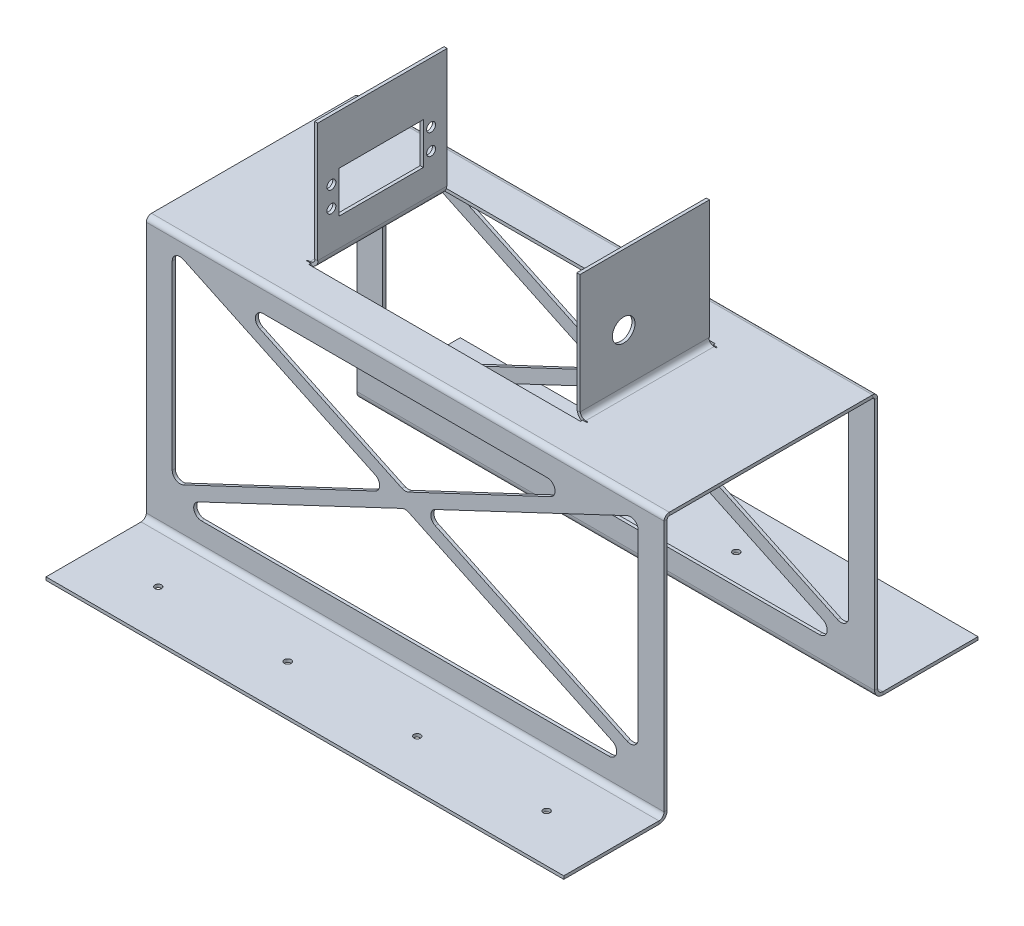
from build123d import *

# Parameters (mm, degrees)
SKETCH1_W                  = 254
SKETCH1_H                  = 50.8
BOSS_EXTRUDE1_DEPTH        = 1.5875
BOSS_EXTRUDE1_2_DEPTH      = 1.5875
SKETCH2_W                  = 254
SKETCH2_H                  = 1.5875
BOSS_EXTRUDE2_DEPTH        = 127
SKETCH3_W                  = 254
SKETCH3_H                  = 104.775
BOSS_EXTRUDE3_DEPTH        = 1.5875
CUT_EXTRUDE1_DEPTH         = 239.299561018
SKETCH5_W                  = 127
SKETCH5_H                  = 63.5
CUT_EXTRUDE2_DEPTH         = 209.31968372
SKETCH6_W                  = 1.5875
SKETCH6_H                  = 63.5
BOSS_EXTRUDE5_DEPTH        = 60.96
CUT_EXTRUDE4_REACH         = 291.401
SKETCH9_R                  = 2.1828125
SKETCH9_W                  = 41.275
SKETCH9_H                  = 20.32
CUT_EXTRUDE5_REACH         = 291.401
SKETCH10_R                 = 5.55625
FILLET1_START              = -31.75
FILLET1_DEPTH              = 63.5
FILLET1_START_2            = -127
FILLET1_2_DEPTH            = 254
FILLET1_START_3            = -33
FILLET1_3_DEPTH            = 66
FILLET1_START_4            = -128
FILLET1_4_DEPTH            = 256
CONVERT_SOLID2_START       = -49.8475
CONVERT_SOLID2_OUTLINE_W   = 133.35
CONVERT_SOLID2_OUTLINE_H   = 0.0635
CONVERT_SOLID2_DEPTH       = 99.695
CONVERT_SOLID2_START_2     = -31.9913
CONVERT_SOLID2_2_DEPTH     = 63.9826
CONVERT_SOLID2_3_DEPTH     = 99.695
CONVERT_SOLID2_START_3     = -103
CONVERT_SOLID2_4_OUTLINE_W = 254
CONVERT_SOLID2_4_OUTLINE_H = 0.0635
CONVERT_SOLID2_4_DEPTH     = 206
CONVERT_SOLID2_START_4     = -31.75
CONVERT_SOLID2_5_DEPTH     = 63.5
CONVERT_SOLID2_6_DEPTH     = 0.4826
CONVERT_SOLID2_START_5     = 31.5087
CONVERT_SOLID2_7_DEPTH     = 0.4826
CONVERT_SOLID2_START_6     = -128
CONVERT_SOLID2_8_DEPTH     = 256
SKETCH15_R                 = 1.63195
CUT_EXTRUDE6_DEPTH         = 250.759513845


with BuildPart() as part:
    # Sketch1 → Boss-Extrude1 (new body)
    with BuildSketch(Plane(origin=(0, 0, 0), x_dir=(1, 0, 0), z_dir=(0, 1, 0))):
        with Locations((0, -76.2)):
            Rectangle(SKETCH1_W, SKETCH1_H)
    extrude(amount=BOSS_EXTRUDE1_DEPTH)



with BuildPart() as body_2:
    # Sketch1 → Boss-Extrude1 2 (new body)
    with BuildSketch(Plane(origin=(0, 0, 0), x_dir=(1, 0, 0), z_dir=(0, 1, 0))):
        with Locations((0, 76.2)):
            Rectangle(SKETCH1_W, SKETCH1_H)
    extrude(amount=BOSS_EXTRUDE1_2_DEPTH)


with BuildPart() as part_1:
    add(part.part)

    add(body_2.part)  # Boss-Extrude2 merges body 2
    # Sketch2 → Boss-Extrude2 (add)
    with BuildSketch(Plane(origin=(0, 1.5875, 0), x_dir=(1, 0, 0), z_dir=(0, 1, 0))):
        with Locations((0, 51.59375)):
            Rectangle(SKETCH2_W, SKETCH2_H)
        with Locations((0, -51.59375)):
            Rectangle(SKETCH2_W, SKETCH2_H)
    extrude(amount=BOSS_EXTRUDE2_DEPTH)

    # Sketch3 → Boss-Extrude3 (add)
    with BuildSketch(Plane(origin=(0, 128.5875, 0), x_dir=(1, 0, 0), z_dir=(0, 1, 0))):
        Rectangle(SKETCH3_W, SKETCH3_H)
    extrude(amount=BOSS_EXTRUDE3_DEPTH)

    # Sketch4 → Cut-Extrude1 (cut, through all)
    with BuildSketch(Plane.XY.offset(52.3875)):
        with BuildLine():
            Line((-69.703104209, 117.475), (69.703104209, 117.475))
            ThreePointArc((69.703104209, 117.475), (73.420782502, 114.498647473), (71.329998233, 110.219812656))
            Line((71.329998233, 110.219812656), (1.626894024, 77.304457891))
            ThreePointArc((1.626894024, 77.304457891), (0, 76.939645235), (-1.626894024, 77.304457891))
            Line((-1.626894024, 77.304457891), (-71.329998233, 110.219812656))
            ThreePointArc((-71.329998233, 110.219812656), (-73.420782502, 114.498647473), (-69.703104209, 117.475))
        make_face()
        with BuildLine():
            Line((-114.3, 117.476188099), (-114.3, 28.573811901))
            ThreePointArc((-114.3, 28.573811901), (-112.52931775, 25.355538589), (-108.863105976, 25.128624557))
            Line((-108.863105976, 25.128624557), (-14.731178238, 69.579812656))
            ThreePointArc((-14.731178238, 69.579812656), (-12.548072262, 73.025), (-14.731178238, 76.470187344))
            Line((-14.731178238, 76.470187344), (-108.863105976, 120.921375443))
            ThreePointArc((-108.863105976, 120.921375443), (-112.52931775, 120.694461411), (-114.3, 117.476188099))
        make_face()
        with BuildLine():
            Line((-99.958986562, 14.2875), (99.958986562, 14.2875))
            ThreePointArc((99.958986562, 14.2875), (103.676664855, 17.263852527), (101.585880586, 21.542687344))
            Line((101.585880586, 21.542687344), (1.626894024, 68.745542109))
            ThreePointArc((1.626894024, 68.745542109), (0, 69.110354765), (-1.626894024, 68.745542109))
            Line((-1.626894024, 68.745542109), (-101.585880586, 21.542687344))
            ThreePointArc((-101.585880586, 21.542687344), (-103.676664855, 17.263852527), (-99.958986562, 14.2875))
        make_face()
        with BuildLine():
            Line((114.3, 117.476188099), (114.3, 28.573811901))
            ThreePointArc((114.3, 28.573811901), (112.52931775, 25.355538589), (108.863105976, 25.128624557))
            Line((108.863105976, 25.128624557), (14.731178238, 69.579812656))
            ThreePointArc((14.731178238, 69.579812656), (12.548072262, 73.025), (14.731178238, 76.470187344))
            Line((14.731178238, 76.470187344), (108.863105976, 120.921375443))
            ThreePointArc((108.863105976, 120.921375443), (112.52931775, 120.694461411), (114.3, 117.476188099))
        make_face()
    extrude(amount=-CUT_EXTRUDE1_DEPTH, mode=Mode.SUBTRACT)

    # Sketch5 → Cut-Extrude2 (cut, through all)
    with BuildSketch(Plane(origin=(0, 130.175, 0), x_dir=(1, 0, 0), z_dir=(0, 1, 0))):
        Rectangle(SKETCH5_W, SKETCH5_H)
        Polygon((63.5, 31.75), (66.675, 31.75), (66.675, 33.02), (-66.675, 33.02), (-66.675, 31.75), (-63.5, 31.75), align=None)
        Polygon((63.5, -31.75), (-63.5, -31.75), (-66.675, -31.75), (-66.675, -33.02), (66.675, -33.02), (66.675, -31.75), align=None)
    extrude(amount=-CUT_EXTRUDE2_DEPTH, mode=Mode.SUBTRACT)

    # Sketch6 → Boss-Extrude5 (add)
    with BuildSketch(Plane(origin=(0, 130.175, 0), x_dir=(1, 0, 0), z_dir=(0, 1, 0))):
        with Locations((-64.29375, 0)):
            Rectangle(SKETCH6_W, SKETCH6_H)
        with Locations((64.29375, 0)):
            Rectangle(SKETCH6_W, SKETCH6_H)
    extrude(amount=BOSS_EXTRUDE5_DEPTH)

    # Sketch9 → Cut-Extrude4 (cut, up to next)
    with BuildSketch(Plane.ZY.offset(65.0875), mode=Mode.PRIVATE) as cut_extrude4_sk1:
        with Locations((-23.870723231, 161.641924234)):
            Circle(SKETCH9_R)
    cut_extrude4_tool1 = extrude(cut_extrude4_sk1.sketch, amount=-CUT_EXTRUDE4_REACH, mode=Mode.PRIVATE) & part_1.part
    # Sketch9 → Cut-Extrude4 (cut, up to next)
    with BuildSketch(Plane.ZY.offset(65.0875), mode=Mode.PRIVATE) as cut_extrude4_sk2:
        with Locations((-23.870723231, 151.481924234)):
            Circle(SKETCH9_R)
    cut_extrude4_tool2 = extrude(cut_extrude4_sk2.sketch, amount=-CUT_EXTRUDE4_REACH, mode=Mode.PRIVATE) & part_1.part
    # Sketch9 → Cut-Extrude4 (cut, up to next)
    with BuildSketch(Plane.ZY.offset(65.0875), mode=Mode.PRIVATE) as cut_extrude4_sk3:
        with Locations((25.024276769, 161.641924234)):
            Circle(SKETCH9_R)
    cut_extrude4_tool3 = extrude(cut_extrude4_sk3.sketch, amount=-CUT_EXTRUDE4_REACH, mode=Mode.PRIVATE) & part_1.part
    # Sketch9 → Cut-Extrude4 (cut, up to next)
    with BuildSketch(Plane.ZY.offset(65.0875), mode=Mode.PRIVATE) as cut_extrude4_sk4:
        with Locations((25.024276769, 151.481924234)):
            Circle(SKETCH9_R)
    cut_extrude4_tool4 = extrude(cut_extrude4_sk4.sketch, amount=-CUT_EXTRUDE4_REACH, mode=Mode.PRIVATE) & part_1.part
    # Sketch9 → Cut-Extrude4 (cut, up to next)
    with BuildSketch(Plane.ZY.offset(65.0875), mode=Mode.PRIVATE) as cut_extrude4_sk5:
        with Locations((0.576776769, 156.561924234)):
            Rectangle(SKETCH9_W, SKETCH9_H)
    cut_extrude4_tool5 = extrude(cut_extrude4_sk5.sketch, amount=-CUT_EXTRUDE4_REACH, mode=Mode.PRIVATE) & part_1.part
    add(cut_extrude4_tool1.solids().sort_by_distance((-65.0875, 161.641924, -23.870723))[0], mode=Mode.SUBTRACT)
    add(cut_extrude4_tool2.solids().sort_by_distance((-65.0875, 151.481924, -23.870723))[0], mode=Mode.SUBTRACT)
    add(cut_extrude4_tool3.solids().sort_by_distance((-65.0875, 161.641924, 25.024277))[0], mode=Mode.SUBTRACT)
    add(cut_extrude4_tool4.solids().sort_by_distance((-65.0875, 151.481924, 25.024277))[0], mode=Mode.SUBTRACT)
    add(cut_extrude4_tool5.solids().sort_by_distance((-65.0875, 156.561924, 0.576777))[0], mode=Mode.SUBTRACT)

    # Sketch10 → Cut-Extrude5 (cut, up to next)
    with BuildSketch(Plane(origin=(65.0875, 0, 0), x_dir=(0, 0, -1), z_dir=(1, 0, 0)), mode=Mode.PRIVATE) as cut_extrude5_sk1:
        with Locations((-10.292276769, 156.845)):
            Circle(SKETCH10_R)
    cut_extrude5_tool1 = extrude(cut_extrude5_sk1.sketch, amount=-CUT_EXTRUDE5_REACH, mode=Mode.PRIVATE) & part_1.part
    add(cut_extrude5_tool1.solids().sort_by_distance((65.0875, 156.845, 10.292277))[0], mode=Mode.SUBTRACT)

    # Fillet1: read off the stored shape, not the designer's step
    # Fillet1 outline → Fillet1 (add)
    with BuildSketch(Plane.XY.offset(FILLET1_START)):
        with BuildLine():
            Line((-67.6275, 130.175), (-65.0875, 130.175))
            Line((-65.0875, 130.175), (-65.0875, 132.715))
            ThreePointArc((-65.0875, 132.715), (-65.831448776, 130.918948776), (-67.6275, 130.175))
        make_face()
        with BuildLine():
            Line((65.0875, 132.715), (65.0875, 130.175))
            Line((65.0875, 130.175), (67.6275, 130.175))
            ThreePointArc((67.6275, 130.175), (65.831448776, 130.918948776), (65.0875, 132.715))
        make_face()
    extrude(amount=FILLET1_DEPTH)

    # Fillet1 2 outline → Fillet1 2 (add)
    with BuildSketch(Plane.YZ.offset(FILLET1_START_2)):
        with BuildLine():
            Line((128.5875, -50.8), (128.5875, -48.26))
            ThreePointArc((128.5875, -48.26), (127.843551224, -50.056051224), (126.0475, -50.8))
            Line((126.0475, -50.8), (128.5875, -50.8))
        make_face()
        with BuildLine():
            ThreePointArc((126.0475, 50.8), (127.843551224, 50.056051224), (128.5875, 48.26))
            Line((128.5875, 48.26), (128.5875, 50.8))
            Line((128.5875, 50.8), (126.0475, 50.8))
        make_face()
        with BuildLine():
            Line((1.5875, -52.3875), (1.5875, -54.9275))
            ThreePointArc((1.5875, -54.9275), (2.331448776, -53.131448776), (4.1275, -52.3875))
            Line((4.1275, -52.3875), (1.5875, -52.3875))
        make_face()
        with BuildLine():
            Line((1.5875, 52.3875), (4.1275, 52.3875))
            ThreePointArc((4.1275, 52.3875), (2.331448776, 53.131448776), (1.5875, 54.9275))
            Line((1.5875, 54.9275), (1.5875, 52.3875))
        make_face()
    extrude(amount=FILLET1_2_DEPTH)

    # Fillet1 3 outline → Fillet1 3 (cut)
    with BuildSketch(Plane.XY.offset(FILLET1_START_3)):
        with BuildLine():
            Line((63.5, 128.5875), (66.04, 128.5875))
            ThreePointArc((66.04, 128.5875), (64.243948776, 129.331448776), (63.5, 131.1275))
            Line((63.5, 131.1275), (63.5, 128.5875))
        make_face()
        with BuildLine():
            Line((-66.04, 128.5875), (-63.5, 128.5875))
            Line((-63.5, 128.5875), (-63.5, 131.1275))
            ThreePointArc((-63.5, 131.1275), (-64.243948776, 129.331448776), (-66.04, 128.5875))
        make_face()
    extrude(amount=FILLET1_3_DEPTH, mode=Mode.SUBTRACT)

    # Fillet1 4 outline → Fillet1 4 (cut)
    with BuildSketch(Plane.YZ.offset(FILLET1_START_4)):
        with BuildLine():
            Line((0, 50.8), (2.54, 50.8))
            ThreePointArc((2.54, 50.8), (0.743948776, 51.543948776), (0, 53.34))
            Line((0, 53.34), (0, 50.8))
        make_face()
        with BuildLine():
            ThreePointArc((0, -53.34), (0.743948776, -51.543948776), (2.54, -50.8))
            Line((2.54, -50.8), (0, -50.8))
            Line((0, -50.8), (0, -53.34))
        make_face()
        with BuildLine():
            ThreePointArc((127.635, 52.3875), (129.431051224, 51.643551224), (130.175, 49.8475))
            Line((130.175, 49.8475), (130.175, 52.3875))
            Line((130.175, 52.3875), (127.635, 52.3875))
        make_face()
        with BuildLine():
            ThreePointArc((130.175, -49.8475), (129.431051224, -51.643551224), (127.635, -52.3875))
            Line((127.635, -52.3875), (130.175, -52.3875))
            Line((130.175, -52.3875), (130.175, -49.8475))
        make_face()
    extrude(amount=FILLET1_4_DEPTH, mode=Mode.SUBTRACT)

    # Convert-Solid2: read off the stored shape, not the designer's step
    # Convert-Solid2 outline → Convert-Solid2 (cut)
    with BuildSketch(Plane.XY.offset(CONVERT_SOLID2_START)):
        with Locations((0, 128.61925)):
            Rectangle(CONVERT_SOLID2_OUTLINE_W, CONVERT_SOLID2_OUTLINE_H)
    extrude(amount=CONVERT_SOLID2_DEPTH, mode=Mode.SUBTRACT)

    # Convert-Solid2 2 outline → Convert-Solid2 2 (cut)
    with BuildSketch(Plane.XY.offset(CONVERT_SOLID2_START_2)):
        with BuildLine():
            Line((66.675, 128.651), (67.6275, 128.651))
            ThreePointArc((67.6275, 128.651), (67.147898618, 128.679398618), (66.675, 128.764197581))
            Line((66.675, 128.764197581), (66.675, 128.651))
        make_face()
        with BuildLine():
            Line((-67.6275, 128.651), (-66.675, 128.651))
            Line((-66.675, 128.651), (-66.675, 128.764197581))
            ThreePointArc((-66.675, 128.764197581), (-67.147898618, 128.679398618), (-67.6275, 128.651))
        make_face()
    extrude(amount=CONVERT_SOLID2_2_DEPTH, mode=Mode.SUBTRACT)

    # Convert-Solid2 3 outline → Convert-Solid2 3 (cut)
    # profile 1 of 3: a face of its own
    with BuildSketch(Plane.XY.offset(CONVERT_SOLID2_START)):
        Polygon((127, 128.651), (66.675, 128.651), (66.675, 128.5875), (-66.675, 128.5875), (-66.675, 128.651), (-127, 128.651), (-127, 0.0635), (127, 0.0635), align=None)
        with BuildLine():
            ThreePointArc((1.626894024, 77.304457891), (0, 76.939645235), (-1.626894024, 77.304457891))
            Line((-1.626894024, 77.304457891), (-71.329998233, 110.219812656))
            ThreePointArc((-71.329998233, 110.219812656), (-73.420782502, 114.498647473), (-69.703104209, 117.475))
            Line((-69.703104209, 117.475), (69.703104209, 117.475))
            ThreePointArc((69.703104209, 117.475), (73.420782502, 114.498647473), (71.329998233, 110.219812656))
            Line((71.329998233, 110.219812656), (1.626894024, 77.304457891))
        make_face(mode=Mode.SUBTRACT)
        with BuildLine():
            Line((-14.731178238, 69.579812656), (-108.863105976, 25.128624557))
            ThreePointArc((-108.863105976, 25.128624557), (-112.529317749, 25.355538589), (-114.3, 28.573811901))
            Line((-114.3, 28.573811901), (-114.3, 117.476188099))
            ThreePointArc((-114.3, 117.476188099), (-112.529317749, 120.694461411), (-108.863105976, 120.921375443))
            Line((-108.863105976, 120.921375443), (-14.731178238, 76.470187344))
            ThreePointArc((-14.731178238, 76.470187344), (-12.548072262, 73.025), (-14.731178238, 69.579812656))
        make_face(mode=Mode.SUBTRACT)
        with BuildLine():
            Line((-101.585880586, 21.542687344), (-1.626894024, 68.745542109))
            ThreePointArc((-1.626894024, 68.745542109), (0, 69.110354765), (1.626894024, 68.745542109))
            Line((1.626894024, 68.745542109), (101.585880586, 21.542687344))
            ThreePointArc((101.585880586, 21.542687344), (103.676664855, 17.263852527), (99.958986562, 14.2875))
            Line((99.958986562, 14.2875), (-99.958986562, 14.2875))
            ThreePointArc((-99.958986562, 14.2875), (-103.676664855, 17.263852527), (-101.585880586, 21.542687344))
        make_face(mode=Mode.SUBTRACT)
        with BuildLine():
            Line((108.863105976, 25.128624557), (14.731178238, 69.579812656))
            ThreePointArc((14.731178238, 69.579812656), (12.548072262, 73.025), (14.731178238, 76.470187344))
            Line((14.731178238, 76.470187344), (108.863105976, 120.921375443))
            ThreePointArc((108.863105976, 120.921375443), (112.529317749, 120.694461411), (114.3, 117.476188099))
            Line((114.3, 117.476188099), (114.3, 28.573811901))
            ThreePointArc((114.3, 28.573811901), (112.529317749, 25.355538589), (108.863105976, 25.128624557))
        make_face(mode=Mode.SUBTRACT)
    # profile 2 of 3: a face of its own
    with BuildSketch(Plane.XY.offset(CONVERT_SOLID2_START)):
        with BuildLine():
            Line((63.68535698, 130.175), (64.455041016, 130.175))
            ThreePointArc((64.455041016, 130.175), (63.792857297, 131.369038876), (63.5635, 132.715))
            Line((63.5635, 132.715), (63.5635, 191.135))
            Line((63.5635, 191.135), (63.5, 191.135))
            Line((63.5, 191.135), (63.5, 131.1275))
            ThreePointArc((63.5, 131.1275), (63.546769839, 130.642316153), (63.68535698, 130.175))
        make_face()
    # profile 3 of 3: a face of its own
    with BuildSketch(Plane.XY.offset(CONVERT_SOLID2_START)):
        with BuildLine():
            Line((-64.455041016, 130.175), (-63.68535698, 130.175))
            ThreePointArc((-63.68535698, 130.175), (-63.546769839, 130.642316153), (-63.5, 131.1275))
            Line((-63.5, 131.1275), (-63.5, 191.135))
            Line((-63.5, 191.135), (-63.5635, 191.135))
            Line((-63.5635, 191.135), (-63.5635, 132.715))
            ThreePointArc((-63.5635, 132.715), (-63.792857297, 131.369038876), (-64.455041016, 130.175))
        make_face()
    extrude(amount=CONVERT_SOLID2_3_DEPTH, mode=Mode.SUBTRACT)

    # Convert-Solid2 4 outline → Convert-Solid2 4 (cut)
    with BuildSketch(Plane.XY.offset(CONVERT_SOLID2_START_3)):
        with Locations((0, 0.03175)):
            Rectangle(CONVERT_SOLID2_4_OUTLINE_W, CONVERT_SOLID2_4_OUTLINE_H)
    extrude(amount=CONVERT_SOLID2_4_DEPTH, mode=Mode.SUBTRACT)

    # Convert-Solid2 5 outline → Convert-Solid2 5 (cut)
    with BuildSketch(Plane.XY.offset(CONVERT_SOLID2_START_4)):
        with BuildLine():
            Line((66.675, 128.651), (66.675, 128.764197581))
            ThreePointArc((66.675, 128.764197581), (65.447726498, 129.285031562), (64.455041016, 130.175))
            Line((64.455041016, 130.175), (63.68535698, 130.175))
            ThreePointArc((63.68535698, 130.175), (64.393534834, 129.193397506), (65.475599655, 128.651))
            Line((65.475599655, 128.651), (66.675, 128.651))
        make_face()
        with BuildLine():
            Line((-66.675, 128.651), (-65.475599655, 128.651))
            ThreePointArc((-65.475599655, 128.651), (-64.393534834, 129.193397506), (-63.68535698, 130.175))
            Line((-63.68535698, 130.175), (-64.455041016, 130.175))
            ThreePointArc((-64.455041016, 130.175), (-65.447726498, 129.285031562), (-66.675, 128.764197581))
            Line((-66.675, 128.764197581), (-66.675, 128.651))
        make_face()
    extrude(amount=CONVERT_SOLID2_5_DEPTH, mode=Mode.SUBTRACT)

    # Convert-Solid2 6 outline → Convert-Solid2 6 (cut)
    with BuildSketch(Plane.XY.offset(CONVERT_SOLID2_START_2)):
        with BuildLine():
            Line((67.6275, 128.651), (68.7705, 128.651))
            Line((68.7705, 128.651), (68.7705, 130.175))
            Line((68.7705, 130.175), (67.6275, 130.175))
            ThreePointArc((67.6275, 130.175), (65.876925809, 130.874595153), (65.090676987, 132.588))
            Line((65.090676987, 132.588), (63.568583179, 132.5118))
            ThreePointArc((63.568583179, 132.5118), (64.826581293, 129.770352245), (67.6275, 128.651))
        make_face()
        with BuildLine():
            Line((-68.7705, 128.651), (-67.6275, 128.651))
            ThreePointArc((-67.6275, 128.651), (-64.826581293, 129.770352245), (-63.568583179, 132.5118))
            Line((-63.568583179, 132.5118), (-65.090676987, 132.588))
            ThreePointArc((-65.090676987, 132.588), (-65.876925809, 130.874595153), (-67.6275, 130.175))
            Line((-67.6275, 130.175), (-68.7705, 130.175))
            Line((-68.7705, 130.175), (-68.7705, 128.651))
        make_face()
    extrude(amount=CONVERT_SOLID2_6_DEPTH, mode=Mode.SUBTRACT)

    # Convert-Solid2 7 outline → Convert-Solid2 7 (cut)
    with BuildSketch(Plane.XY.offset(CONVERT_SOLID2_START_5)):
        with BuildLine():
            Line((67.6275, 128.651), (68.7705, 128.651))
            Line((68.7705, 128.651), (68.7705, 130.175))
            Line((68.7705, 130.175), (67.6275, 130.175))
            ThreePointArc((67.6275, 130.175), (65.876925809, 130.874595153), (65.090676987, 132.588))
            Line((65.090676987, 132.588), (63.568583179, 132.5118))
            ThreePointArc((63.568583179, 132.5118), (64.826581293, 129.770352245), (67.6275, 128.651))
        make_face()
        with BuildLine():
            Line((-68.7705, 128.651), (-67.6275, 128.651))
            ThreePointArc((-67.6275, 128.651), (-64.826581293, 129.770352245), (-63.568583179, 132.5118))
            Line((-63.568583179, 132.5118), (-65.090676987, 132.588))
            ThreePointArc((-65.090676987, 132.588), (-65.876925809, 130.874595153), (-67.6275, 130.175))
            Line((-67.6275, 130.175), (-68.7705, 130.175))
            Line((-68.7705, 130.175), (-68.7705, 128.651))
        make_face()
    extrude(amount=CONVERT_SOLID2_7_DEPTH, mode=Mode.SUBTRACT)

    # Convert-Solid2 8 outline → Convert-Solid2 8 (cut)
    with BuildSketch(Plane.YZ.offset(CONVERT_SOLID2_START_6)):
        with BuildLine():
            ThreePointArc((4.1275, 50.8635), (1.253818041, 52.053818041), (0.0635, 54.9275))
            Line((0.0635, 54.9275), (0.0635, 52.775599655))
            ThreePointArc((0.0635, 52.775599655), (0.956014027, 51.354404765), (2.54, 50.8))
            Line((2.54, 50.8), (126.0475, 50.8))
            ThreePointArc((126.0475, 50.8), (127.147352263, 50.54952506), (128.030286864, 49.8475))
            Line((128.030286864, 49.8475), (128.651, 49.8475))
            ThreePointArc((128.651, 49.8475), (128.35342049, 50.56592049), (127.635, 50.8635))
            Line((127.635, 50.8635), (4.1275, 50.8635))
        make_face()
        with BuildLine():
            Line((0.0635, -52.775599655), (0.0635, -54.9275))
            ThreePointArc((0.0635, -54.9275), (1.253818041, -52.053818041), (4.1275, -50.8635))
            Line((4.1275, -50.8635), (127.635, -50.8635))
            ThreePointArc((127.635, -50.8635), (128.35342049, -50.56592049), (128.651, -49.8475))
            Line((128.651, -49.8475), (128.030286864, -49.8475))
            ThreePointArc((128.030286864, -49.8475), (127.147352263, -50.54952506), (126.0475, -50.8))
            Line((126.0475, -50.8), (2.54, -50.8))
            ThreePointArc((2.54, -50.8), (0.956014027, -51.354404765), (0.0635, -52.775599655))
        make_face()
    extrude(amount=CONVERT_SOLID2_8_DEPTH, mode=Mode.SUBTRACT)

    # Sketch15 → Cut-Extrude6 (cut, through all)
    with BuildSketch(Plane(origin=(0, 1.5875, 0), x_dir=(1, 0, 0), z_dir=(0, 1, 0))):
        with Locations(Location((-95.25, -78.26375, 0), (0, 0, 270))):
            Circle(SKETCH15_R)
        with Locations(Location((-31.75, -78.26375, 0), (0, 0, 270))):
            Circle(SKETCH15_R)
        with Locations(Location((31.75, -78.26375, 0), (0, 0, 270))):
            Circle(SKETCH15_R)
        with Locations(Location((95.25, -78.26375, 0), (0, 0, 270))):
            Circle(SKETCH15_R)
        with Locations(Location((-95.25, 78.26375, 0), (0, 0, 270))):
            Circle(SKETCH15_R)
        with Locations(Location((95.25, 78.26375, 0), (0, 0, 270))):
            Circle(SKETCH15_R)
        with Locations(Location((-31.75, 78.26375, 0), (0, 0, 270))):
            Circle(SKETCH15_R)
        with Locations(Location((31.75, 78.26375, 0), (0, 0, 270))):
            Circle(SKETCH15_R)
    extrude(amount=-CUT_EXTRUDE6_DEPTH, mode=Mode.SUBTRACT)


solid = part_1.part
